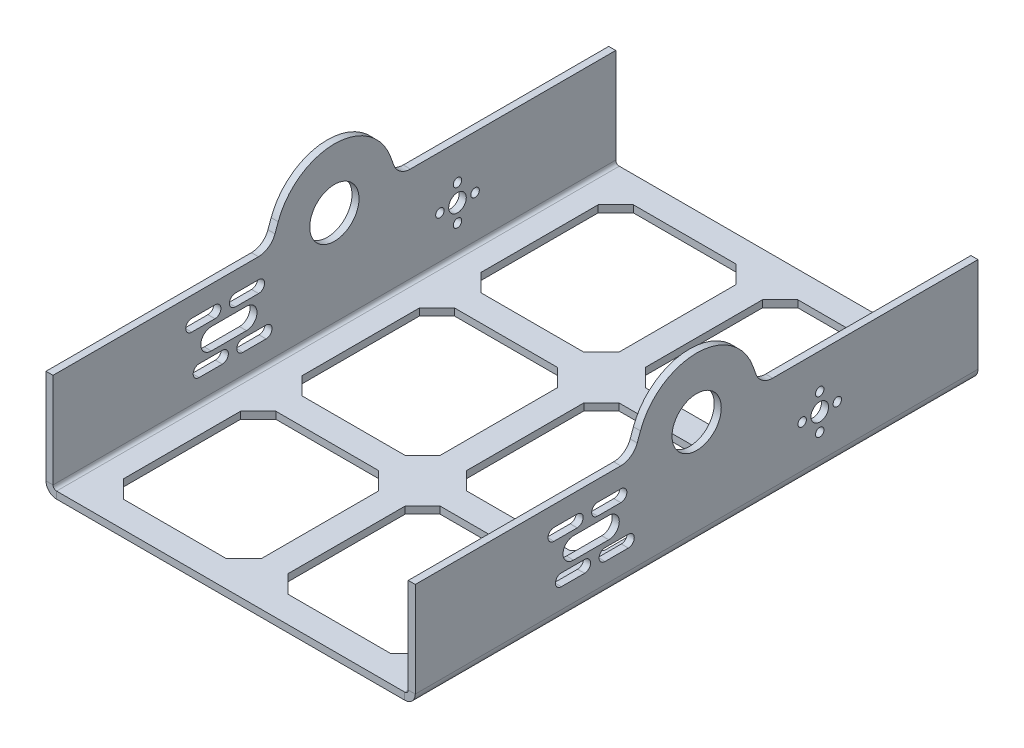
from build123d import *

# Parameters (mm, degrees)
BOSS_EXTRUDE1_DEPTH       = 30
BOSS_EXTRUDE2_DEPTH       = 105
FILLET1_R                 = 5
CONVERT_SOLID2_START      = -80
CONVERT_SOLID2_DEPTH      = 160
SKETCH12_R                = 7
SKETCH12_R_2              = 2.5
AXLE_HOLES_DEPTH          = 141.121375957
SKETCH13_W                = 39.25
SKETCH13_H                = 43.333333333
SKETCH13_H_2              = 43.333333334
WEIGHT_SAVING_HOLES_DEPTH = 2
CHAMFER1_SIZE             = 5
M3_START                  = -52.5
M3_CLEARANCE_SLOT1_DEPTH  = 105
M2_CLEARANCE_HOLE1_D      = 2.4


# Read off the part's stored shape, not the designer's step: Convert-Solid2, M3 Clearance Slot1
with BuildPart() as part:
    # Sketch1 → Boss-Extrude1 (new body)
    with BuildSketch(Plane(origin=(0, 0, 0), x_dir=(1, 0, 0), z_dir=(0, 1, 0))):
        Polygon((-52.5, -80), (0, -80), (52.5, -80), (52.5, 80), (-52.5, 80), align=None)
    extrude(amount=BOSS_EXTRUDE1_DEPTH)

    # Sketch11 → Boss-Extrude2 (add)
    with BuildSketch(Plane(origin=(52.5, 0, 0), x_dir=(0, 0, -1), z_dir=(1, 0, 0))):
        with BuildLine():
            Line((-18.091022132, 30), (-15.974774553, 35.814342437))
            ThreePointArc((-15.974774553, 35.814342437), (0, 47), (15.974774553, 35.814342437))
            Line((15.974774553, 35.814342437), (18.091022132, 30))
            Line((18.091022132, 30), (-18.091022132, 30))
        make_face()
    extrude(amount=-BOSS_EXTRUDE2_DEPTH)

    # Fillet1
    fillet1_edges = [part.edges().sort_by_distance(p)[0] for p in [
        (0, 30, -18.091022132),
        (0, 30, 18.091022132),
    ]]
    fillet(fillet1_edges, radius=FILLET1_R)

    # Convert-Solid2 outline → Convert-Solid2 (cut)
    with BuildSketch(Plane.XY.offset(CONVERT_SOLID2_START)):
        with BuildLine():
            Line((-54, 5.2e-08), (-49.5, 0))
            ThreePointArc((-49.5, 0), (-51.621320344, 0.878679656), (-52.5, 3))
            Line((-52.5, 3), (-52.499999977, 48))
            Line((-52.499999977, 48), (-54, 48))
            Line((-54, 48), (-54, 5.2e-08))
        make_face()
        with BuildLine():
            ThreePointArc((52.5, 3), (51.621320344, 0.878679656), (49.5, 0))
            Line((49.5, 0), (54, 5.2e-08))
            Line((54, 5.2e-08), (54, 48))
            Line((54, 48), (52.499999977, 48))
            Line((52.499999977, 48), (52.5, 3))
        make_face()
        with BuildLine():
            Line((50.5, 3), (50.5, 48))
            Line((50.5, 48), (-50.5, 48))
            Line((-50.5, 48), (-50.5, 3))
            ThreePointArc((-50.5, 3), (-50.207106781, 2.292893219), (-49.5, 2))
            Line((-49.5, 2), (49.5, 2))
            ThreePointArc((49.5, 2), (50.207106781, 2.292893219), (50.5, 3))
        make_face()
    extrude(amount=CONVERT_SOLID2_DEPTH, mode=Mode.SUBTRACT)

    # Sketch12 → Axle Holes (cut, through all)
    with BuildSketch(Plane(origin=(52.5, 0, 0), x_dir=(0, 0, -1), z_dir=(1, 0, 0))):
        with Locations((0, 30)):
            Circle(SKETCH12_R)
        with Locations((35, 15)):
            Circle(SKETCH12_R_2)
        with BuildLine():
            Line((-35, 19.5), (-25, 19.5))
            ThreePointArc((-25, 19.5), (-22, 16.5), (-25, 13.5))
            Line((-25, 13.5), (-35, 13.5))
            ThreePointArc((-35, 13.5), (-38, 16.5), (-35, 19.5))
        make_face()
    extrude(amount=-AXLE_HOLES_DEPTH, mode=Mode.SUBTRACT)

    # Sketch13 → Weight Saving Holes (cut)
    with BuildSketch(Plane(origin=(0, 2, 0), x_dir=(1, 0, 0), z_dir=(0, 1, 0))):
        with Locations((-23.375, 50.833333334)):
            Rectangle(SKETCH13_W, SKETCH13_H)
        with Locations((-23.375, 0)):
            Rectangle(SKETCH13_W, SKETCH13_H_2)
        with Locations((-23.375, -50.833333334)):
            Rectangle(SKETCH13_W, SKETCH13_H)
        with Locations((23.375, -50.833333334)):
            Rectangle(SKETCH13_W, SKETCH13_H)
        with Locations((23.375, 0)):
            Rectangle(SKETCH13_W, SKETCH13_H_2)
        with Locations((23.375, 50.833333334)):
            Rectangle(SKETCH13_W, SKETCH13_H)
    extrude(amount=-WEIGHT_SAVING_HOLES_DEPTH, mode=Mode.SUBTRACT)

    # Chamfer1
    chamfer1_edges = [part.edges().sort_by_distance(p)[0] for p in [
        (43, 1, -72.5),
        (3.75, 1, -72.5),
        (3.75, 1, -29.166666667),
        (43, 1, -29.166666667),
        (43, 1, -21.666666667),
        (3.75, 1, -21.666666667),
        (3.75, 1, 21.666666667),
        (43, 1, 21.666666667),
        (43, 1, 29.166666667),
        (3.75, 1, 29.166666667),
        (3.75, 1, 72.5),
        (43, 1, 72.5),
        (-43, 1, 29.166666667),
        (-43, 1, 72.5),
        (-3.75, 1, 72.5),
        (-3.75, 1, 29.166666667),
        (-43, 1, -21.666666667),
        (-43, 1, 21.666666667),
        (-3.75, 1, 21.666666667),
        (-3.75, 1, -21.666666667),
        (-43, 1, -72.5),
        (-43, 1, -29.166666667),
        (-3.75, 1, -29.166666667),
        (-3.75, 1, -72.5),
    ]]
    chamfer(chamfer1_edges, length=CHAMFER1_SIZE)

    # M3 Clearance Slot1 outline → M3 Clearance Slot1 (cut)
    with BuildSketch(Plane.YZ.offset(M3_START)):
        with BuildLine():
            ThreePointArc((12.080710415, 26.033343618), (10.380710415, 27.733343618), (8.680710415, 26.033343618))
            Line((8.680710415, 26.033343618), (8.680710415, 19.433343618))
            ThreePointArc((8.680710415, 19.433343618), (10.380710415, 17.733343618), (12.080710415, 19.433343618))
            Line((12.080710415, 19.433343618), (12.080710415, 26.033343618))
        make_face()
        with BuildLine():
            ThreePointArc((12.080710415, 38.453085966), (10.380710415, 40.153085966), (8.680710415, 38.453085966))
            Line((8.680710415, 38.453085966), (8.680710415, 31.853085966))
            ThreePointArc((8.680710415, 31.853085966), (10.380710415, 30.153085966), (12.080710415, 31.853085966))
            Line((12.080710415, 31.853085966), (12.080710415, 38.453085966))
        make_face()
        with BuildLine():
            ThreePointArc((24.319289585, 40.566656382), (22.619289585, 42.266656382), (20.919289585, 40.566656382))
            Line((20.919289585, 40.566656382), (20.919289585, 33.966656382))
            ThreePointArc((20.919289585, 33.966656382), (22.619289585, 32.266656382), (24.319289585, 33.966656382))
            Line((24.319289585, 33.966656382), (24.319289585, 40.566656382))
        make_face()
        with BuildLine():
            ThreePointArc((24.319289585, 28.146914034), (22.619289585, 29.846914034), (20.919289585, 28.146914034))
            Line((20.919289585, 28.146914034), (20.919289585, 21.546914034))
            ThreePointArc((20.919289585, 21.546914034), (22.619289585, 19.846914034), (24.319289585, 21.546914034))
            Line((24.319289585, 21.546914034), (24.319289585, 28.146914034))
        make_face()
    extrude(amount=M3_CLEARANCE_SLOT1_DEPTH, mode=Mode.SUBTRACT)

    # M2 Clearance Hole1 (through all)
    with Locations(Plane.ZY.offset(52.5)):
        with Locations((-35, 20), (-30, 15), (-35, 10), (-40, 15)):
            Hole(M2_CLEARANCE_HOLE1_D / 2)


solid = part.part
